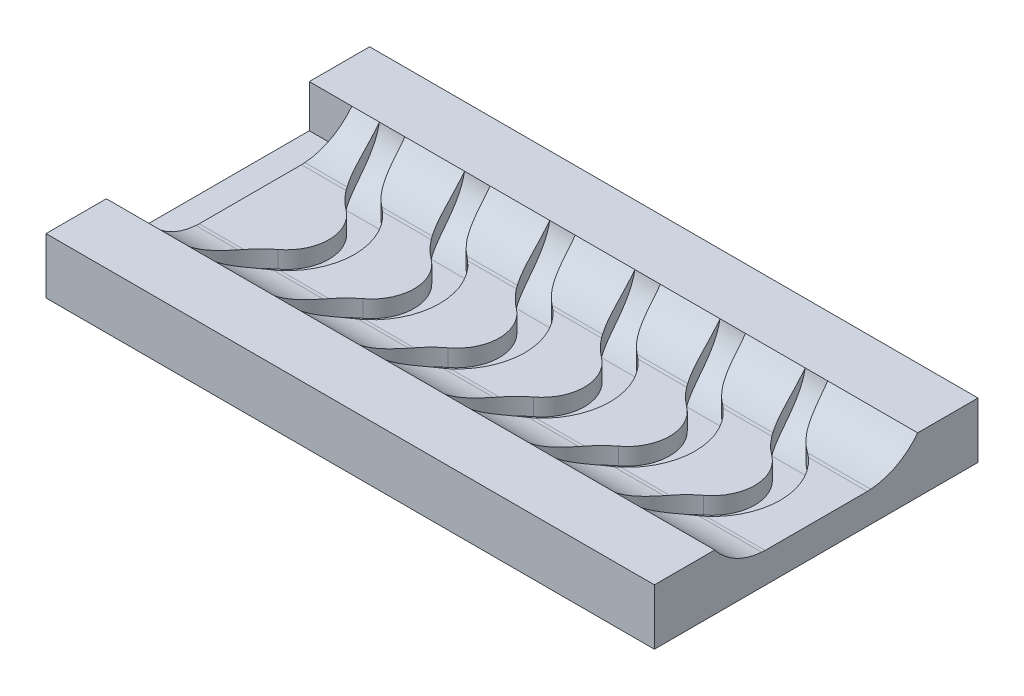
from build123d import *
from build123d.topology import SkipClean

# Parameters (mm, degrees)
SKETCH1_W            = 56
SKETCH1_H            = 24
BOSS_EXTRUDE1_DEPTH  = 10
SKETCH2_W            = 70
SKETCH2_H            = 38
BOSS_EXTRUDE2_DEPTH  = 7
CUT_EXTRUDE8_DEPTH   = 2
CUT_EXTRUDE10_DEPTH  = 2
CUT_EXTRUDE11_DEPTH  = 2
CUT_EXTRUDE12_DEPTH  = 2
CUT_EXTRUDE13_DEPTH  = 2
CUT_EXTRUDE14_DEPTH  = 2
SKETCH9_W            = 2.87264454
SKETCH9_H            = 24
CUT_EXTRUDE15_DEPTH  = 5
SKETCH10_W           = 24
SKETCH10_H           = 5
CUT_EXTRUDE16_DEPTH  = 18
BOSS_EXTRUDE3_START  = 3
BOSS_EXTRUDE3_DEPTH  = 3
BOSS_EXTRUDE4_DEPTH  = 149
CUT_EXTRUDE17_REACH  = 156.199
SKETCH14_R           = 4
SKETCH15_W           = 38
SKETCH15_H           = 5.821798295
CUT_EXTRUDE18_DEPTH  = 103
SKETCH16_W           = 38
SKETCH16_H           = 10
BOSS_EXTRUDE5_DEPTH  = 7
SKETCH17_W           = 5.389872087
SKETCH17_H           = 2
CUT_EXTRUDE19_DEPTH  = 12
CUT_EXTRUDE20_DEPTH  = 2
BOSS_EXTRUDE6_DEPTH  = 15
CUT_EXTRUDE21_START  = -5
CUT_EXTRUDE21_DEPTH  = 5
BOSS_EXTRUDE9_START  = 3
BOSS_EXTRUDE9_DEPTH  = 3
BOSS_EXTRUDE10_DEPTH = 5
CUT_EXTRUDE22_DEPTH  = 5
CUT_EXTRUDE23_START  = -49
CUT_EXTRUDE23_DEPTH  = 49
BOSS_EXTRUDE11_START = -120
BOSS_EXTRUDE11_DEPTH = 120
CUT_EXTRUDE25_START  = -43
CUT_EXTRUDE25_DEPTH  = 43
CUT_EXTRUDE27_START  = -15
CUT_EXTRUDE27_DEPTH  = 15
CUT_EXTRUDE33_START  = -13.555108511
CUT_EXTRUDE33_DEPTH  = 13.555108511
CUT_EXTRUDE34_DEPTH  = 20
SKETCH43_W           = 38
SKETCH43_H           = 10
CUT_EXTRUDE35_DEPTH  = 7
CUT_EXTRUDE38_DEPTH  = 67
BOSS_EXTRUDE16_START = 2
BOSS_EXTRUDE16_DEPTH = 2
SKETCH46_W           = 38
SKETCH46_H           = 3.449270663
CUT_EXTRUDE39_DEPTH  = 79
BOSS_EXTRUDE17_DEPTH = 5


# Read off the part's stored shape, not the designer's step: Cut-Extrude21
with BuildPart() as part:
    # Sketch1 → Boss-Extrude1 (new body)
    with BuildSketch(Plane(origin=(0, 0, 0), x_dir=(1, 0, 0), z_dir=(0, 1, 0))):
        Polygon((-71.036942105, -38.149752846), (-8.036942105, -38.149752846), (-1.036942105, -38.149752846), (-1.036942105, -0.149752846), (-71.036942105, -0.149752846), align=None)
        with Locations((-36.036942105, -19.149752846)):
            Rectangle(SKETCH1_W, SKETCH1_H, mode=Mode.SUBTRACT)
    extrude(amount=BOSS_EXTRUDE1_DEPTH)

    # Sketch2 → Boss-Extrude2 (add)
    with BuildSketch(Plane.XZ):
        with Locations((-36.036942105, 19.149752846)):
            Rectangle(SKETCH2_W, SKETCH2_H)
    extrude(amount=-BOSS_EXTRUDE2_DEPTH)

    # Sketch3 → Cut-Extrude8 (cut)
    with BuildSketch(Plane(origin=(0, 7, 0), x_dir=(1, 0, 0), z_dir=(0, 1, 0))):
        with BuildLine():
            Line((-19.24851185, -31.149752846), (-16.24851185, -31.149752846))
            ThreePointArc((-16.24851185, -31.149752846), (-15.509502185, -28.019257672), (-13.448511841, -25.549752839))
            ThreePointArc((-13.448511841, -25.549752839), (-10.249398009, -19.030682482), (-13.641129982, -12.609719793))
            ThreePointArc((-13.641129982, -12.609719793), (-15.761818316, -10.226514402), (-16.604744928, -7.149752846))
            Line((-16.604744928, -7.149752846), (-19.24851185, -7.149752846))
            ThreePointArc((-19.24851185, -7.149752846), (-18.192783772, -11.621888777), (-15.248511893, -15.149752813))
            ThreePointArc((-15.248511893, -15.149752813), (-13.24851185, -19.14975286), (-15.248511915, -23.149752894))
            ThreePointArc((-15.248511915, -23.149752894), (-18.192783778, -26.677616927), (-19.24851185, -31.149752846))
        make_face()
    extrude(amount=-CUT_EXTRUDE8_DEPTH, mode=Mode.SUBTRACT)

    # Sketch4 → Cut-Extrude10 (cut)
    with BuildSketch(Plane(origin=(0, 7, 0), x_dir=(1, 0, 0), z_dir=(0, 1, 0))):
        with BuildLine():
            ThreePointArc((-25.248511794, -15.149752887), (-23.24851185, -19.149752907), (-25.248511893, -23.149752878))
            ThreePointArc((-25.248511893, -23.149752878), (-28.192783772, -26.677616914), (-29.24851185, -31.149752846))
            Line((-29.24851185, -31.149752846), (-26.24851185, -31.149752846))
            ThreePointArc((-26.24851185, -31.149752846), (-25.509502185, -28.019257672), (-23.448511841, -25.549752839))
            ThreePointArc((-23.448511841, -25.549752839), (-20.24851185, -19.149752846), (-23.448511841, -12.749752852))
            ThreePointArc((-23.448511841, -12.749752852), (-25.509502185, -10.280248019), (-26.24851185, -7.149752846))
            Line((-26.24851185, -7.149752846), (-29.24851185, -7.149752846))
            ThreePointArc((-29.24851185, -7.149752846), (-28.192783745, -11.621888832), (-25.248511794, -15.149752887))
        make_face()
    extrude(amount=-CUT_EXTRUDE10_DEPTH, mode=Mode.SUBTRACT)

    # Sketch5 → Cut-Extrude11 (cut)
    with BuildSketch(Plane(origin=(0, 7, 0), x_dir=(1, 0, 0), z_dir=(0, 1, 0))):
        with BuildLine():
            ThreePointArc((-35.248511724, -15.14975294), (-33.24851185, -19.149752846), (-35.248511724, -23.149752751))
            ThreePointArc((-35.248511724, -23.149752751), (-38.192783725, -26.67761682), (-39.24851185, -31.149752846))
            Line((-39.24851185, -31.149752846), (-36.24851185, -31.149752846))
            ThreePointArc((-36.24851185, -31.149752846), (-35.509502185, -28.019257672), (-33.448511841, -25.549752839))
            ThreePointArc((-33.448511841, -25.549752839), (-30.24851185, -19.149752771), (-33.44851196, -12.749752763))
            ThreePointArc((-33.44851196, -12.749752763), (-35.509502218, -10.280247952), (-36.24851185, -7.149752846))
            Line((-36.24851185, -7.149752846), (-39.24851185, -7.149752846))
            ThreePointArc((-39.24851185, -7.149752846), (-38.192783725, -11.621888871), (-35.248511724, -15.14975294))
        make_face()
    extrude(amount=-CUT_EXTRUDE11_DEPTH, mode=Mode.SUBTRACT)

    # Sketch6 → Cut-Extrude12 (cut)
    with BuildSketch(Plane(origin=(0, 7, 0), x_dir=(1, 0, 0), z_dir=(0, 1, 0))):
        with BuildLine():
            ThreePointArc((-45.24851166, -15.149752988), (-43.24851185, -19.149752991), (-45.248511893, -23.149752878))
            ThreePointArc((-45.248511893, -23.149752878), (-48.192783772, -26.677616914), (-49.24851185, -31.149752846))
            Line((-49.24851185, -31.149752846), (-46.24851185, -31.149752846))
            ThreePointArc((-46.24851185, -31.149752846), (-45.509502185, -28.019257672), (-43.448511841, -25.549752839))
            ThreePointArc((-43.448511841, -25.549752839), (-40.24851185, -19.149752888), (-43.448511772, -12.749752904))
            ThreePointArc((-43.448511772, -12.749752904), (-45.509502165, -10.280248057), (-46.24851185, -7.149752846))
            Line((-46.24851185, -7.149752846), (-49.24851185, -7.149752846))
            ThreePointArc((-49.24851185, -7.149752846), (-48.192783707, -11.621888907), (-45.24851166, -15.149752988))
        make_face()
    extrude(amount=-CUT_EXTRUDE12_DEPTH, mode=Mode.SUBTRACT)

    # Sketch7 → Cut-Extrude13 (cut)
    with BuildSketch(Plane(origin=(0, 7, 0), x_dir=(1, 0, 0), z_dir=(0, 1, 0))):
        with BuildLine():
            ThreePointArc((-55.248511853, -15.149752843), (-53.24851185, -19.149752765), (-55.248511724, -23.149752751))
            ThreePointArc((-55.248511724, -23.149752751), (-58.192783725, -26.67761682), (-59.24851185, -31.149752846))
            Line((-59.24851185, -31.149752846), (-56.24851185, -31.149752846))
            ThreePointArc((-56.24851185, -31.149752846), (-55.509502185, -28.019257672), (-53.448511841, -25.549752839))
            ThreePointArc((-53.448511841, -25.549752839), (-50.24851185, -19.149752914), (-53.448511731, -12.749752935))
            ThreePointArc((-53.448511731, -12.749752935), (-55.509502154, -10.280248081), (-56.24851185, -7.149752846))
            Line((-56.24851185, -7.149752846), (-59.24851185, -7.149752846))
            ThreePointArc((-59.24851185, -7.149752846), (-58.192783761, -11.621888799), (-55.248511853, -15.149752843))
        make_face()
    extrude(amount=-CUT_EXTRUDE13_DEPTH, mode=Mode.SUBTRACT)

    # Sketch8 → Cut-Extrude14 (cut)
    with BuildSketch(Plane(origin=(0, 7, 0), x_dir=(1, 0, 0), z_dir=(0, 1, 0))):
        with BuildLine():
            ThreePointArc((-64.036942105, -25.951420309), (-61.259500548, -23.042530905), (-60.24851185, -19.149752846))
            Line((-60.24851185, -19.149752846), (-63.24851185, -19.149752846))
            ThreePointArc((-63.24851185, -19.149752846), (-63.449665701, -20.553702858), (-64.036942105, -21.844688889))
            Line((-64.036942105, -21.844688889), (-64.036942105, -25.951420309))
        make_face()
        with BuildLine():
            Line((-63.24851185, -19.149752846), (-60.24851185, -19.149752846))
            ThreePointArc((-60.24851185, -19.149752846), (-61.259500548, -15.256974786), (-64.036942105, -12.348085382))
            Line((-64.036942105, -12.348085382), (-64.036942105, -16.454816802))
            ThreePointArc((-64.036942105, -16.454816802), (-63.449665701, -17.745802833), (-63.24851185, -19.149752846))
        make_face()
        with BuildLine():
            ThreePointArc((-64.036942105, -25.951420309), (-61.259500548, -23.042530905), (-60.24851185, -19.149752846))
            Line((-60.24851185, -19.149752846), (-63.24851185, -19.149752846))
            ThreePointArc((-63.24851185, -19.149752846), (-63.449665701, -20.553702858), (-64.036942105, -21.844688889))
            Line((-64.036942105, -21.844688889), (-64.036942105, -25.951420309))
        make_face()
        with BuildLine():
            Line((-63.24851185, -19.149752846), (-60.24851185, -19.149752846))
            ThreePointArc((-60.24851185, -19.149752846), (-61.259500548, -15.256974786), (-64.036942105, -12.348085382))
            Line((-64.036942105, -12.348085382), (-64.036942105, -16.454816802))
            ThreePointArc((-64.036942105, -16.454816802), (-63.449665701, -17.745802833), (-63.24851185, -19.149752846))
        make_face()
    extrude(amount=-CUT_EXTRUDE14_DEPTH, mode=Mode.SUBTRACT)

    # Sketch9 → Cut-Extrude15 (cut)
    with BuildSketch(Plane(origin=(0, 10, 0), x_dir=(1, 0, 0), z_dir=(0, 1, 0))):
        with Locations((-6.600619835, -19.149752846)):
            Rectangle(SKETCH9_W, SKETCH9_H)
    extrude(amount=-CUT_EXTRUDE15_DEPTH, mode=Mode.SUBTRACT)

    # Sketch10 → Cut-Extrude16 (cut)
    with BuildSketch(Plane.ZY.offset(5.164297565)):
        with Locations((19.149752846, 7.5)):
            Rectangle(SKETCH10_W, SKETCH10_H)
    extrude(amount=-CUT_EXTRUDE16_DEPTH, mode=Mode.SUBTRACT)

    # Sketch12 → Boss-Extrude3 (add)
    with BuildSketch(Plane(origin=(0, 7, 0), x_dir=(1, 0, 0), z_dir=(0, 1, 0)).offset(BOSS_EXTRUDE3_START)):
        with BuildLine():
            Line((-16.24851185, -31.149752846), (-8.036942105, -31.149752846))
            Line((-8.036942105, -31.149752846), (-8.036942105, -7.149752846))
            Line((-8.036942105, -7.149752846), (-16.604744928, -7.149752846))
            ThreePointArc((-16.604744928, -7.149752846), (-15.761818318, -10.226514398), (-13.641129989, -12.609719789))
            ThreePointArc((-13.641129989, -12.609719789), (-10.249398009, -19.030682483), (-13.44851185, -25.549752846))
            ThreePointArc((-13.44851185, -25.549752846), (-15.509502187, -28.019257677), (-16.24851185, -31.149752846))
        make_face()
        with BuildLine():
            Line((-26.24851185, -31.149752846), (-19.24851185, -31.149752846))
            ThreePointArc((-19.24851185, -31.149752846), (-18.19278376, -26.677616891), (-15.24851185, -23.149752846))
            ThreePointArc((-15.24851185, -23.149752846), (-13.24851185, -19.149752846), (-15.24851185, -15.149752846))
            ThreePointArc((-15.24851185, -15.149752846), (-18.19278376, -11.621888801), (-19.24851185, -7.149752846))
            Line((-19.24851185, -7.149752846), (-26.24851185, -7.149752846))
            ThreePointArc((-26.24851185, -7.149752846), (-25.509502187, -10.280248014), (-23.44851185, -12.749752846))
            ThreePointArc((-23.44851185, -12.749752846), (-20.24851185, -19.149752846), (-23.44851185, -25.549752846))
            ThreePointArc((-23.44851185, -25.549752846), (-25.509502187, -28.019257677), (-26.24851185, -31.149752846))
        make_face()
        with BuildLine():
            Line((-36.24851185, -31.149752846), (-29.24851185, -31.149752846))
            ThreePointArc((-29.24851185, -31.149752846), (-28.19278376, -26.677616891), (-25.24851185, -23.149752846))
            ThreePointArc((-25.24851185, -23.149752846), (-23.24851185, -19.149752846), (-25.24851185, -15.149752846))
            ThreePointArc((-25.24851185, -15.149752846), (-28.19278376, -11.621888801), (-29.24851185, -7.149752846))
            Line((-29.24851185, -7.149752846), (-36.24851185, -7.149752846))
            ThreePointArc((-36.24851185, -7.149752846), (-35.509502187, -10.280248014), (-33.44851185, -12.749752846))
            ThreePointArc((-33.44851185, -12.749752846), (-30.24851185, -19.149752846), (-33.44851185, -25.549752846))
            ThreePointArc((-33.44851185, -25.549752846), (-35.509502187, -28.019257677), (-36.24851185, -31.149752846))
        make_face()
        with BuildLine():
            Line((-46.24851185, -31.149752846), (-39.24851185, -31.149752846))
            ThreePointArc((-39.24851185, -31.149752846), (-38.19278376, -26.677616891), (-35.24851185, -23.149752846))
            ThreePointArc((-35.24851185, -23.149752846), (-33.24851185, -19.149752846), (-35.24851185, -15.149752846))
            ThreePointArc((-35.24851185, -15.149752846), (-38.19278376, -11.621888801), (-39.24851185, -7.149752846))
            Line((-39.24851185, -7.149752846), (-46.24851185, -7.149752846))
            ThreePointArc((-46.24851185, -7.149752846), (-45.509502187, -10.280248014), (-43.44851185, -12.749752846))
            ThreePointArc((-43.44851185, -12.749752846), (-40.24851185, -19.149752846), (-43.44851185, -25.549752846))
            ThreePointArc((-43.44851185, -25.549752846), (-45.509502187, -28.019257677), (-46.24851185, -31.149752846))
        make_face()
        with BuildLine():
            Line((-56.24851185, -31.149752846), (-49.24851185, -31.149752846))
            ThreePointArc((-49.24851185, -31.149752846), (-48.19278376, -26.677616891), (-45.24851185, -23.149752846))
            ThreePointArc((-45.24851185, -23.149752846), (-43.24851185, -19.149752846), (-45.24851185, -15.149752846))
            ThreePointArc((-45.24851185, -15.149752846), (-48.19278376, -11.621888801), (-49.24851185, -7.149752846))
            Line((-49.24851185, -7.149752846), (-56.24851185, -7.149752846))
            ThreePointArc((-56.24851185, -7.149752846), (-55.509502187, -10.280248014), (-53.44851185, -12.749752846))
            ThreePointArc((-53.44851185, -12.749752846), (-50.24851185, -19.149752846), (-53.44851185, -25.549752846))
            ThreePointArc((-53.44851185, -25.549752846), (-55.509502187, -28.019257677), (-56.24851185, -31.149752846))
        make_face()
        with BuildLine():
            Line((-64.036942105, -7.149752846), (-64.036942105, -12.348085382))
            ThreePointArc((-64.036942105, -12.348085382), (-60.24851185, -19.149752846), (-64.036942105, -25.951420309))
            Line((-64.036942105, -25.951420309), (-64.036942105, -31.149752846))
            Line((-64.036942105, -31.149752846), (-59.24851185, -31.149752846))
            ThreePointArc((-59.24851185, -31.149752846), (-58.19278376, -26.677616891), (-55.24851185, -23.149752846))
            ThreePointArc((-55.24851185, -23.149752846), (-53.24851185, -19.149752846), (-55.24851185, -15.149752846))
            ThreePointArc((-55.24851185, -15.149752846), (-58.19278376, -11.621888801), (-59.24851185, -7.149752846))
            Line((-59.24851185, -7.149752846), (-64.036942105, -7.149752846))
        make_face()
        with BuildLine():
            Line((-64.036942105, -16.454816802), (-64.036942105, -21.844688889))
            ThreePointArc((-64.036942105, -21.844688889), (-63.24851185, -19.149752846), (-64.036942105, -16.454816802))
        make_face()
    extrude(amount=-BOSS_EXTRUDE3_DEPTH)

    # Sketch13 → Boss-Extrude4 (add)
    with BuildSketch(Plane(origin=(-1.036942105, 0, 0), x_dir=(0, 0, -1), z_dir=(1, 0, 0))):
        with BuildLine():
            Line((-31.149752846, 10), (-31.149752846, 5))
            Line((-31.149752846, 5), (-25.149752846, 5))
            ThreePointArc((-25.149752846, 5), (-29.392393533, 6.757359313), (-31.149752846, 11))
            Line((-31.149752846, 11), (-31.149752846, 10))
        make_face()
        with BuildLine():
            ThreePointArc((-7.149752846, 11), (-8.907112158, 6.757359313), (-13.149752846, 5))
            Line((-13.149752846, 5), (-7.149752846, 5))
            Line((-7.149752846, 5), (-7.149752846, 10))
            Line((-7.149752846, 10), (-7.149752846, 11))
        make_face()
    extrude(amount=-BOSS_EXTRUDE4_DEPTH)

    # Cut-Extrude17: up to this face of the body (flat: up to its plane)
    cut_extrude17_end = Plane(part.part.faces().sort_by_distance((-64.036942105, 7.501737064, 23.896758638))[0])
    # Sketch14 → Cut-Extrude17 (cut, up to the picked face)
    with BuildSketch(Plane(origin=(-1.036942105, 0, 0), x_dir=(0, 0, -1), z_dir=(1, 0, 0)), mode=Mode.PRIVATE) as cut_extrude17_sk1:
        with Locations((-25.149752846, 11)):
            Circle(SKETCH14_R)
    cut_extrude17_tool1 = split(extrude(cut_extrude17_sk1.sketch, amount=-CUT_EXTRUDE17_REACH, mode=Mode.PRIVATE), bisect_by=cut_extrude17_end, keep=Keep.BOTH, mode=Mode.PRIVATE)
    # Sketch14 → Cut-Extrude17 (cut, up to the picked face)
    with BuildSketch(Plane(origin=(-1.036942105, 0, 0), x_dir=(0, 0, -1), z_dir=(1, 0, 0)), mode=Mode.PRIVATE) as cut_extrude17_sk2:
        with BuildLine():
            ThreePointArc((-13.149752846, 15), (-17.149752846, 11), (-13.149752846, 7))
            Line((-13.149752846, 7), (-13.149752846, 15))
        make_face()
    cut_extrude17_tool2 = split(extrude(cut_extrude17_sk2.sketch, amount=-CUT_EXTRUDE17_REACH, mode=Mode.PRIVATE), bisect_by=cut_extrude17_end, keep=Keep.BOTH, mode=Mode.PRIVATE)
    # Sketch14 → Cut-Extrude17 (cut, up to the picked face)
    with BuildSketch(Plane(origin=(-1.036942105, 0, 0), x_dir=(0, 0, -1), z_dir=(1, 0, 0)), mode=Mode.PRIVATE) as cut_extrude17_sk3:
        with BuildLine():
            Line((-13.149752846, 15), (-13.149752846, 7))
            ThreePointArc((-13.149752846, 7), (-10.321325721, 8.171572875), (-9.149752846, 11))
            ThreePointArc((-9.149752846, 11), (-10.321325721, 13.828427125), (-13.149752846, 15))
        make_face()
    cut_extrude17_tool3 = split(extrude(cut_extrude17_sk3.sketch, amount=-CUT_EXTRUDE17_REACH, mode=Mode.PRIVATE), bisect_by=cut_extrude17_end, keep=Keep.BOTH, mode=Mode.PRIVATE)
    # Sketch14 → Cut-Extrude17 (cut, up to the picked face)
    with BuildSketch(Plane(origin=(-1.036942105, 0, 0), x_dir=(0, 0, -1), z_dir=(1, 0, 0)), mode=Mode.PRIVATE) as cut_extrude17_sk4:
        with BuildLine():
            ThreePointArc((-13.149752846, 15), (-17.149752846, 11), (-13.149752846, 7))
            Line((-13.149752846, 7), (-13.149752846, 15))
        make_face()
    cut_extrude17_tool4 = split(extrude(cut_extrude17_sk4.sketch, amount=-CUT_EXTRUDE17_REACH, mode=Mode.PRIVATE), bisect_by=cut_extrude17_end, keep=Keep.BOTH, mode=Mode.PRIVATE)
    # Sketch14 → Cut-Extrude17 (cut, up to the picked face)
    with BuildSketch(Plane(origin=(-1.036942105, 0, 0), x_dir=(0, 0, -1), z_dir=(1, 0, 0)), mode=Mode.PRIVATE) as cut_extrude17_sk5:
        with BuildLine():
            Line((-13.149752846, 15), (-13.149752846, 7))
            ThreePointArc((-13.149752846, 7), (-10.321325721, 8.171572875), (-9.149752846, 11))
            ThreePointArc((-9.149752846, 11), (-10.321325721, 13.828427125), (-13.149752846, 15))
        make_face()
    cut_extrude17_tool5 = split(extrude(cut_extrude17_sk5.sketch, amount=-CUT_EXTRUDE17_REACH, mode=Mode.PRIVATE), bisect_by=cut_extrude17_end, keep=Keep.BOTH, mode=Mode.PRIVATE)
    # Sketch14 → Cut-Extrude17 (cut, up to the picked face)
    with BuildSketch(Plane(origin=(-1.036942105, 0, 0), x_dir=(0, 0, -1), z_dir=(1, 0, 0)), mode=Mode.PRIVATE) as cut_extrude17_sk6:
        with BuildLine():
            ThreePointArc((-21.149752846, 11), (-22.321325721, 8.171572875), (-25.149752846, 7))
            Line((-25.149752846, 7), (-13.149752846, 7))
            ThreePointArc((-13.149752846, 7), (-17.149752846, 11), (-13.149752846, 15))
            Line((-13.149752846, 15), (-25.149752846, 15))
            ThreePointArc((-25.149752846, 15), (-22.321325721, 13.828427125), (-21.149752846, 11))
        make_face()
    cut_extrude17_tool6 = split(extrude(cut_extrude17_sk6.sketch, amount=-CUT_EXTRUDE17_REACH, mode=Mode.PRIVATE), bisect_by=cut_extrude17_end, keep=Keep.BOTH, mode=Mode.PRIVATE)
    add(cut_extrude17_tool1.solids().sort_by(Axis((-1.036942, 11, 25.149753), (-1, 0, 0)))[0], mode=Mode.SUBTRACT)
    add(cut_extrude17_tool2.solids().sort_by(Axis((-1.036942, 11, 14.847406), (-1, 0, 0)))[0], mode=Mode.SUBTRACT)
    add(cut_extrude17_tool3.solids().sort_by(Axis((-1.036942, 11, 11.4521), (-1, 0, 0)))[0], mode=Mode.SUBTRACT)
    add(cut_extrude17_tool4.solids().sort_by(Axis((-1.036942, 11, 14.847406), (-1, 0, 0)))[0], mode=Mode.SUBTRACT)
    add(cut_extrude17_tool5.solids().sort_by(Axis((-1.036942, 11, 11.4521), (-1, 0, 0)))[0], mode=Mode.SUBTRACT)
    add(cut_extrude17_tool6.solids().sort_by(Axis((-1.036942, 11, 19.149753), (-1, 0, 0)))[0], mode=Mode.SUBTRACT)

    # Sketch15 → Cut-Extrude18 (cut)
    with BuildSketch(Plane(origin=(-1.036942105, 0, 0), x_dir=(0, 0, -1), z_dir=(1, 0, 0))):
        with Locations((-19.149752846, 12.910899148)):
            Rectangle(SKETCH15_W, SKETCH15_H)
    extrude(amount=-CUT_EXTRUDE18_DEPTH, mode=Mode.SUBTRACT)

    # Sketch16 → Boss-Extrude5 (add)
    with BuildSketch(Plane(origin=(-1.036942105, 0, 0), x_dir=(0, 0, -1), z_dir=(1, 0, 0))):
        with Locations((-19.149752846, 5)):
            Rectangle(SKETCH16_W, SKETCH16_H)
    extrude(amount=-BOSS_EXTRUDE5_DEPTH)

    # Sketch17 → Cut-Extrude19 (cut)
    with BuildSketch(Plane(origin=(-64.036942105, 0, 0), x_dir=(0, 0, -1), z_dir=(1, 0, 0))):
        with BuildLine():
            ThreePointArc((-13.149752846, 5), (-12.748017595, 5.013464375), (-12.348085382, 5.053797071))
            Line((-12.348085382, 5.053797071), (-12.348085382, 7.081157151))
            ThreePointArc((-12.348085382, 7.081157151), (-10.3942128, 8.10051745), (-9.276769499, 10))
            Line((-9.276769499, 10), (-29.022736192, 10))
            ThreePointArc((-29.022736192, 10), (-27.905292891, 8.10051745), (-25.951420309, 7.081157151))
            Line((-25.951420309, 7.081157151), (-25.951420309, 5.053797071))
            ThreePointArc((-25.951420309, 5.053797071), (-25.551488096, 5.013464375), (-25.149752846, 5))
            Line((-25.149752846, 5), (-21.844688889, 5))
            Line((-21.844688889, 5), (-21.844688889, 7))
            Line((-21.844688889, 7), (-16.454816802, 7))
            Line((-16.454816802, 7), (-16.454816802, 5))
            Line((-16.454816802, 5), (-13.149752846, 5))
        make_face()
        with Locations((-19.149752846, 6)):
            Rectangle(SKETCH17_W, SKETCH17_H)
    extrude(amount=-CUT_EXTRUDE19_DEPTH, mode=Mode.SUBTRACT)

    # Sketch18 → Cut-Extrude20 (cut)
    with BuildSketch(Plane(origin=(0, 7, 0), x_dir=(1, 0, 0), z_dir=(0, 1, 0))):
        with BuildLine():
            Line((-64.036942105, -16.454816802), (-64.036942105, -21.844688889))
            ThreePointArc((-64.036942105, -21.844688889), (-63.24851185, -19.149752846), (-64.036942105, -16.454816802))
        make_face()
    extrude(amount=-CUT_EXTRUDE20_DEPTH, mode=Mode.SUBTRACT)

    # Sketch19 → Boss-Extrude6 (add)
    with BuildSketch(Plane.ZY.offset(71.036942105)):
        Polygon((25.149752846, 5), (13.149752846, 5), (7.149752846, 5), (7.149752846, 10), (0.149752846, 10), (0.149752846, 0), (38.149752846, 0), (38.149752846, 10), (31.149752846, 10), (31.149752846, 5), align=None)
    extrude(amount=BOSS_EXTRUDE6_DEPTH)

    # Cut-Extrude21 outline → Cut-Extrude21 (cut)
    with BuildSketch(Plane(origin=(0, 10, 0), x_dir=(1, 0, 0), z_dir=(0, 1, 0)).offset(CUT_EXTRUDE21_START)):
        with BuildLine():
            ThreePointArc((-60.519517063, -17.085136759), (-61.611990929, -14.682472905), (-63.426838975, -12.766064986))
            ThreePointArc((-63.426838975, -12.766064986), (-65.454615089, -10.323759217), (-66.181320664, -7.233673062))
            Line((-66.181320664, -7.233673062), (-69.181320664, -7.233673062))
            ThreePointArc((-69.181320664, -7.233673062), (-66.707927929, -13.792601683), (-60.519517063, -17.085136759))
        make_face()
        with BuildLine():
            ThreePointArc((-63.426838975, -25.533440705), (-61.611990929, -23.617032786), (-60.519517063, -21.214368932))
            ThreePointArc((-60.519517063, -21.214368932), (-66.707927929, -24.506904009), (-69.181320664, -31.065832629))
            Line((-69.181320664, -31.065832629), (-66.181320664, -31.065832629))
            ThreePointArc((-66.181320664, -31.065832629), (-65.454615089, -27.975746474), (-63.426838975, -25.533440705))
        make_face()
    extrude(amount=CUT_EXTRUDE21_DEPTH, mode=Mode.SUBTRACT)

    # Sketch24 → Boss-Extrude9 (add)
    with BuildSketch(Plane(origin=(0, 7, 0), x_dir=(1, 0, 0), z_dir=(0, 1, 0)).offset(BOSS_EXTRUDE9_START)):
        with BuildLine():
            ThreePointArc((-62.957009228, -13.149752846), (-60.24851185, -19.149752846), (-62.957009228, -25.149752846))
            Line((-62.957009228, -25.149752846), (-57.24851185, -25.149752846))
            ThreePointArc((-57.24851185, -25.149752846), (-56.319579662, -24.078685034), (-55.24851185, -23.149752846))
            ThreePointArc((-55.24851185, -23.149752846), (-53.24851185, -19.149752846), (-55.24851185, -15.149752846))
            ThreePointArc((-55.24851185, -15.149752846), (-56.319579662, -14.220820657), (-57.24851185, -13.149752846))
            Line((-57.24851185, -13.149752846), (-62.957009228, -13.149752846))
        make_face()
        with BuildLine():
            Line((-57.24851185, -25.149752846), (-62.957009228, -25.149752846))
            ThreePointArc((-62.957009228, -25.149752846), (-63.188286188, -25.346051438), (-63.426838975, -25.533440705))
            ThreePointArc((-63.426838975, -25.533440705), (-64.924887453, -27.085445344), (-65.873450478, -29.022736192))
            Line((-65.873450478, -29.022736192), (-59.019683743, -29.022736192))
            ThreePointArc((-59.019683743, -29.022736192), (-58.342665885, -26.990863283), (-57.24851185, -25.149752846))
        make_face()
        with BuildLine():
            ThreePointArc((-63.426838975, -12.766064986), (-63.188286188, -12.953454253), (-62.957009228, -13.149752846))
            Line((-62.957009228, -13.149752846), (-57.24851185, -13.149752846))
            ThreePointArc((-57.24851185, -13.149752846), (-58.342665885, -11.308642408), (-59.019683743, -9.276769499))
            Line((-59.019683743, -9.276769499), (-65.873450478, -9.276769499))
            ThreePointArc((-65.873450478, -9.276769499), (-64.924887453, -11.214060347), (-63.426838975, -12.766064986))
        make_face()
    extrude(amount=-BOSS_EXTRUDE9_DEPTH)

    # Sketch25 → Boss-Extrude10 (add)
    with BuildSketch(Plane(origin=(0, 10, 0), x_dir=(1, 0, 0), z_dir=(0, 1, 0))):
        Polygon((-72.481833593, -7.233673062), (-61.581700406, -7.233673062), (-59.566549733, -14.340870557), (-58.176258746, -19.244262025), (-61.581700406, -28.355327512), (-64.4212309, -33.393204195), (-72.481833593, -33.393204195), align=None)
    extrude(amount=-BOSS_EXTRUDE10_DEPTH)

    # Sketch26 → Cut-Extrude22 (cut)
    with BuildSketch(Plane(origin=(0, 10, 0), x_dir=(1, 0, 0), z_dir=(0, 1, 0))):
        with BuildLine():
            ThreePointArc((-65.248511779, -15.149752899), (-63.24851185, -19.149752917), (-65.248511893, -23.149752878))
            ThreePointArc((-65.248511893, -23.149752878), (-68.173939736, -26.640125692), (-69.248159714, -31.065832629))
            Line((-69.248159714, -31.065832629), (-66.248008789, -31.065832629))
            ThreePointArc((-66.248008789, -31.065832629), (-65.490624228, -27.98178298), (-63.448511841, -25.549752839))
            ThreePointArc((-63.448511841, -25.549752839), (-60.24851185, -19.149752846), (-63.448511841, -12.749752852))
            ThreePointArc((-63.448511841, -12.749752852), (-65.490624228, -10.317722711), (-66.248008789, -7.233673062))
            Line((-66.248008789, -7.233673062), (-69.248159714, -7.233673062))
            ThreePointArc((-69.248159714, -7.233673062), (-68.173939704, -11.659380062), (-65.248511779, -15.149752899))
        make_face()
    extrude(amount=-CUT_EXTRUDE22_DEPTH, mode=Mode.SUBTRACT)

    # Sketch27 → Cut-Extrude23 (cut)
    with BuildSketch(Plane.ZY.offset(150.036942105).offset(CUT_EXTRUDE23_START)):
        with BuildLine():
            Line((7.149752846, 11), (7.149752846, 5))
            Line((7.149752846, 5), (13.149752846, 5))
            ThreePointArc((13.149752846, 5), (8.907112158, 6.757359313), (7.149752846, 11))
        make_face()
        with BuildLine():
            Line((25.149752846, 5), (31.149752846, 5))
            Line((31.149752846, 5), (31.149752846, 11))
            ThreePointArc((31.149752846, 11), (29.392393533, 6.757359313), (25.149752846, 5))
        make_face()
    extrude(amount=CUT_EXTRUDE23_DEPTH, mode=Mode.SUBTRACT)

    # Sketch28 → Boss-Extrude11 (add)
    with BuildSketch(Plane.ZY.offset(101.036942105).offset(BOSS_EXTRUDE11_START)):
        with BuildLine():
            Line((25.149752846, 5), (31.149752846, 5))
            Line((31.149752846, 5), (31.149752846, 10))
            Line((31.149752846, 10), (31.065832629, 10))
            ThreePointArc((31.065832629, 10), (29.022736192, 6.417424305), (25.149752846, 5))
        make_face()
        with BuildLine():
            Line((7.149752846, 10), (7.149752846, 5))
            Line((7.149752846, 5), (13.149752846, 5))
            ThreePointArc((13.149752846, 5), (9.276769499, 6.417424305), (7.233673062, 10))
            Line((7.233673062, 10), (7.149752846, 10))
        make_face()
    extrude(amount=BOSS_EXTRUDE11_DEPTH)

    # Sketch29 → Cut-Extrude25 (cut)
    with BuildSketch(Plane.ZY.offset(86.036942105).offset(CUT_EXTRUDE25_START)):
        with BuildLine():
            ThreePointArc((13.149752846, 15), (9.149752846, 11), (13.149752846, 7))
            ThreePointArc((13.149752846, 7), (15.97817997, 8.171572875), (17.149752846, 11))
            ThreePointArc((17.149752846, 11), (15.97817997, 13.828427125), (13.149752846, 15))
        make_face()
        with BuildLine():
            ThreePointArc((25.149752846, 15), (21.149752846, 11), (25.149752846, 7))
            ThreePointArc((25.149752846, 7), (27.97817997, 8.171572875), (29.149752846, 11))
            ThreePointArc((29.149752846, 11), (27.97817997, 13.828427125), (25.149752846, 15))
        make_face()
        with BuildLine():
            ThreePointArc((25.149752846, 15), (21.149752846, 11), (25.149752846, 7))
            ThreePointArc((25.149752846, 7), (27.97817997, 8.171572875), (29.149752846, 11))
            ThreePointArc((29.149752846, 11), (27.97817997, 13.828427125), (25.149752846, 15))
        make_face()
        with BuildLine():
            ThreePointArc((13.149752846, 15), (9.149752846, 11), (13.149752846, 7))
            ThreePointArc((13.149752846, 7), (15.97817997, 8.171572875), (17.149752846, 11))
            ThreePointArc((17.149752846, 11), (15.97817997, 13.828427125), (13.149752846, 15))
        make_face()
        with BuildLine():
            ThreePointArc((17.149752846, 11), (15.97817997, 8.171572875), (13.149752846, 7))
            Line((13.149752846, 7), (25.149752846, 7))
            ThreePointArc((25.149752846, 7), (21.149752846, 11), (25.149752846, 15))
            Line((25.149752846, 15), (13.149752846, 15))
            ThreePointArc((13.149752846, 15), (15.97817997, 13.828427125), (17.149752846, 11))
        make_face()
        with BuildLine():
            ThreePointArc((17.149752846, 11), (15.97817997, 8.171572875), (13.149752846, 7))
            Line((13.149752846, 7), (25.149752846, 7))
            ThreePointArc((25.149752846, 7), (21.149752846, 11), (25.149752846, 15))
            Line((25.149752846, 15), (13.149752846, 15))
            ThreePointArc((13.149752846, 15), (15.97817997, 13.828427125), (17.149752846, 11))
        make_face()
    extrude(amount=CUT_EXTRUDE25_DEPTH, mode=Mode.SUBTRACT)

    # Sketch31 → Cut-Extrude27 (cut)
    with BuildSketch(Plane.ZY.offset(101.036942105).offset(CUT_EXTRUDE27_START)):
        with BuildLine():
            Line((7.149752846, 10), (7.149752846, 5))
            Line((7.149752846, 5), (13.149752846, 5))
            ThreePointArc((13.149752846, 5), (9.276769499, 6.417424305), (7.233673062, 10))
            Line((7.233673062, 10), (7.149752846, 10))
        make_face()
        with BuildLine():
            Line((25.149752846, 5), (31.149752846, 5))
            Line((31.149752846, 5), (31.149752846, 10))
            Line((31.149752846, 10), (31.065832629, 10))
            ThreePointArc((31.065832629, 10), (29.022736192, 6.417424305), (25.149752846, 5))
        make_face()
    extrude(amount=CUT_EXTRUDE27_DEPTH, mode=Mode.SUBTRACT)

    # Sketch34 → Cut-Extrude33 (cut)
    with BuildSketch(Plane.ZY.offset(86.036942105).offset(CUT_EXTRUDE33_START)):
        with BuildLine():
            Line((38.149752846, 10), (31.065832629, 10))
            ThreePointArc((31.065832629, 10), (29.022736192, 6.417424305), (25.149752846, 5))
            Line((25.149752846, 5), (13.149752846, 5))
            ThreePointArc((13.149752846, 5), (9.276769499, 6.417424305), (7.233673062, 10))
            Line((7.233673062, 10), (0.149752846, 10))
            Line((0.149752846, 10), (0.149752846, 0))
            Line((0.149752846, 0), (38.149752846, 0))
            Line((38.149752846, 0), (38.149752846, 10))
        make_face()
    extrude(amount=CUT_EXTRUDE33_DEPTH, mode=Mode.SUBTRACT)

    # Sketch32 → Cut-Extrude34 (cut)
    with BuildSketch(Plane(origin=(18.963057895, 0, 0), x_dir=(0, 0, -1), z_dir=(1, 0, 0))):
        with BuildLine():
            Line((-7.149752846, 10), (-7.233673062, 10))
            ThreePointArc((-7.233673062, 10), (-9.276769499, 6.417424305), (-13.149752846, 5))
            Line((-13.149752846, 5), (-7.149752846, 5))
            Line((-7.149752846, 5), (-7.149752846, 10))
        make_face()
        with BuildLine():
            Line((-31.065832629, 10), (-31.149752846, 10))
            Line((-31.149752846, 10), (-31.149752846, 5))
            Line((-31.149752846, 5), (-25.149752846, 5))
            ThreePointArc((-25.149752846, 5), (-29.022736192, 6.417424305), (-31.065832629, 10))
        make_face()
    extrude(amount=-CUT_EXTRUDE34_DEPTH, mode=Mode.SUBTRACT)

    # Sketch43 → Cut-Extrude35 (cut)
    with BuildSketch(Plane(origin=(-1.036942105, 0, 0), x_dir=(0, 0, -1), z_dir=(1, 0, 0))):
        with Locations((-19.149752846, 5)):
            Rectangle(SKETCH43_W, SKETCH43_H)
    extrude(amount=-CUT_EXTRUDE35_DEPTH, mode=Mode.SUBTRACT)

    # Sketch44 → Cut-Extrude38 (cut)
    with BuildSketch(Plane(origin=(-8.036942105, 0, 0), x_dir=(0, 0, -1), z_dir=(1, 0, 0))):
        with BuildLine():
            ThreePointArc((-31.065832629, 10), (-28.624763609, 7.923291534), (-25.549752846, 7.020050252))
            ThreePointArc((-25.549752846, 7.020050252), (-27.754483502, 7.964315859), (-29.022736192, 10))
            Line((-29.022736192, 10), (-31.065832629, 10))
        make_face()
        with BuildLine():
            ThreePointArc((-9.276769499, 10), (-10.545022189, 7.964315859), (-12.749752846, 7.020050252))
            ThreePointArc((-12.749752846, 7.020050252), (-9.674742082, 7.923291534), (-7.233673062, 10))
            Line((-7.233673062, 10), (-9.276769499, 10))
        make_face()
    extrude(amount=-CUT_EXTRUDE38_DEPTH, mode=Mode.SUBTRACT)

    # Sketch45 → Boss-Extrude16 (add)
    with SkipClean():  # the faces are left unmerged after this step: merging them gives an invalid solid
        with BuildSketch(Plane(origin=(-8.036942105, 0, 0), x_dir=(0, 0, -1), z_dir=(1, 0, 0)).offset(BOSS_EXTRUDE16_START)):
            with BuildLine():
                Line((-31.065832629, 10), (-38.149752846, 10))
                Line((-38.149752846, 10), (-38.149752846, 0))
                Line((-38.149752846, 0), (-0.149752846, 0))
                Line((-0.149752846, 0), (-0.149752846, 10))
                Line((-0.149752846, 10), (-7.233673062, 10))
                ThreePointArc((-7.233673062, 10), (-9.674742082, 7.923291534), (-12.749752846, 7.020050252))
                ThreePointArc((-12.749752846, 7.020050252), (-12.949501745, 7.005015708), (-13.149752846, 7))
                Line((-13.149752846, 7), (-25.149752846, 7))
                ThreePointArc((-25.149752846, 7), (-25.350003946, 7.005015708), (-25.549752846, 7.020050252))
                ThreePointArc((-25.549752846, 7.020050252), (-28.624763609, 7.923291534), (-31.065832629, 10))
            make_face()
        extrude(amount=-BOSS_EXTRUDE16_DEPTH)

    # Sketch46 → Cut-Extrude39 (cut)
    with BuildSketch(Plane(origin=(-6.036942105, 0, 0), x_dir=(0, 0, -1), z_dir=(1, 0, 0))):
        with Locations((-19.149752846, 1.724635332)):
            Rectangle(SKETCH46_W, SKETCH46_H)
    extrude(amount=-CUT_EXTRUDE39_DEPTH, mode=Mode.SUBTRACT)

    # Sketch47 → Boss-Extrude17 (add)
    with BuildSketch(Plane.ZY.offset(72.481833593)):
        Polygon((7.233673062, 5), (7.233673062, 10), (0.149752846, 10), (0.149752846, 3.449270663), (7.233673062, 3.449270663), align=None)
        Polygon((19.149752846, 5), (7.233673062, 5), (7.233673062, 3.449270663), (31.065832629, 3.449270663), (31.065832629, 5), align=None)
        Polygon((31.065832629, 5), (31.065832629, 3.449270663), (38.149752846, 3.449270663), (38.149752846, 10), (31.065832629, 10), align=None)
    extrude(amount=BOSS_EXTRUDE17_DEPTH)


solid = part.part
